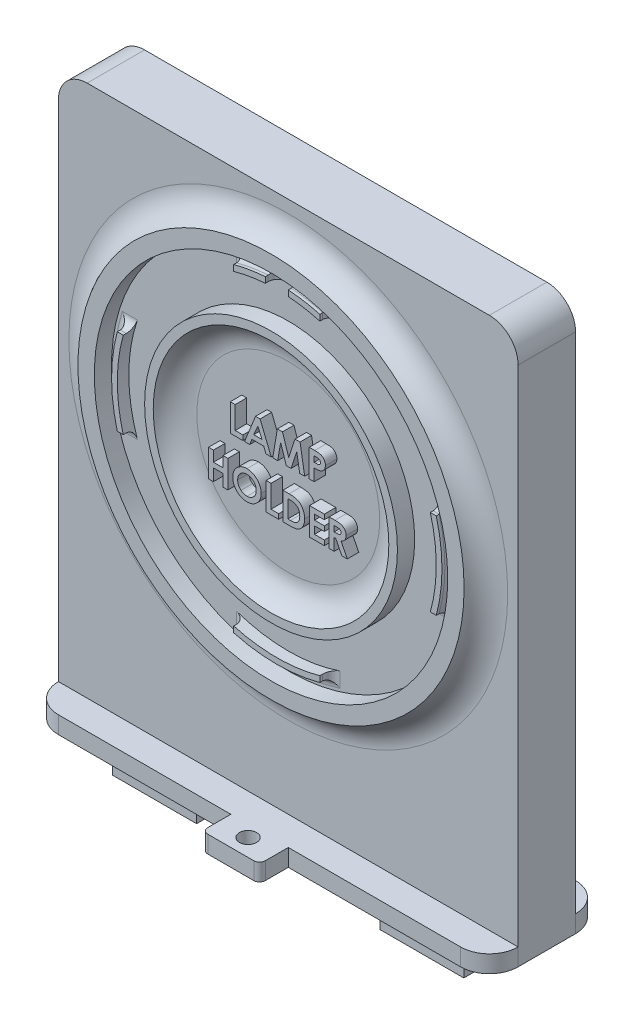
from build123d import *

# Parameters (mm, degrees)
SKETCH1_W           = 80
SKETCH1_H           = 110.7
BOSS_EXTRUDE1_DEPTH = 10
BOSS_EXTRUDE2_DEPTH = 10
SKETCH11_W          = 80
SKETCH11_H          = 15
CUT_EXTRUDE1_DEPTH  = 10
SKETCH4_R           = 1.5
BOSS_EXTRUDE3_DEPTH = 3
SKETCH5_R           = 33.6
SKETCH5_R_2         = 30.75
BOSS_EXTRUDE4_DEPTH = 3
BOSS_EXTRUDE5_DEPTH = 2
SKETCH13_R          = 22
SKETCH13_R_2        = 20.5
BOSS_EXTRUDE6_DEPTH = 3
FILLET1_R           = 5
FILLET2_R           = 1.5
FILLET3_R           = 5
BOSS_EXTRUDE7_DEPTH = 2


with BuildPart() as part:
    # Sketch1 → Boss-Extrude1 (new body)
    with BuildSketch(Plane.XY):
        Rectangle(SKETCH1_W, SKETCH1_H)
    extrude(amount=BOSS_EXTRUDE1_DEPTH)

    # Sketch3 → Boss-Extrude2 (add)
    with BuildSketch(Plane(origin=(0, 0, 0), x_dir=(-1, 0, 0), z_dir=(0, 0, -1))):
        Polygon((-20.95, -59.05), (-15.95, -59.05), (-15.95, -61.75), (-30.55, -61.75), (-30.55, -59.05), (-25.55, -59.05), (-25.55, -55.35), (-20.95, -55.35), align=None)
        Polygon((30.55, -59.05), (30.55, -61.75), (15.95, -61.75), (15.95, -59.05), (20.95, -59.05), (20.95, -55.35), (25.55, -55.35), (25.55, -59.05), align=None)
    extrude(amount=-BOSS_EXTRUDE2_DEPTH)

    # Sketch11 → Cut-Extrude1 (cut)
    with BuildSketch(Plane.XY.offset(10)):
        with Locations((0, 47.85)):
            Rectangle(SKETCH11_W, SKETCH11_H)
    extrude(amount=-CUT_EXTRUDE1_DEPTH, mode=Mode.SUBTRACT)

    # Sketch4 → Boss-Extrude3 (add)
    # profile 1 of 2: a face of its own
    with BuildSketch(Plane.XZ.offset(55.35)):
        with BuildLine():
            Line((20.95, 10), (40, 10))
            ThreePointArc((40, 10), (38.535533906, 13.535533906), (35, 15))
            Line((35, 15), (5, 15))
            Line((5, 15), (5, 19))
            ThreePointArc((5, 19), (4.707106781, 19.707106781), (4, 20))
            Line((4, 20), (-4, 20))
            ThreePointArc((-4, 20), (-4.707106781, 19.707106781), (-5, 19))
            Line((-5, 19), (-5, 15))
            Line((-5, 15), (-35, 15))
            ThreePointArc((-35, 15), (-38.535533906, 13.535533906), (-40, 10))
            Line((-40, 10), (-20.95, 10))
            Line((-20.95, 10), (20.95, 10))
        make_face()
        with Locations(Location((0, 17, 0), (0, 0, 270))):
            Circle(SKETCH4_R, mode=Mode.SUBTRACT)
    # profile 2 of 2: a face of its own
    with BuildSketch(Plane.XZ.offset(55.35)):
        with BuildLine():
            Line((5, -9), (5, -5))
            Line((5, -5), (35, -5))
            ThreePointArc((35, -5), (38.535533906, -3.535533906), (40, 0))
            Line((40, 0), (20.95, 0))
            Line((20.95, 0), (-20.95, 0))
            Line((-20.95, 0), (-40, 0))
            ThreePointArc((-40, 0), (-38.535533906, -3.535533906), (-35, -5))
            Line((-35, -5), (-5, -5))
            Line((-5, -5), (-5, -9))
            ThreePointArc((-5, -9), (-4.707106781, -9.707106781), (-4, -10))
            Line((-4, -10), (4, -10))
            ThreePointArc((4, -10), (4.707106781, -9.707106781), (5, -9))
        make_face()
        with Locations(Location((0, -7, 0), (0, 0, 270))):
            Circle(SKETCH4_R, mode=Mode.SUBTRACT)
    extrude(amount=-BOSS_EXTRUDE3_DEPTH)

    # Sketch5 → Boss-Extrude4 (add)
    with BuildSketch(Plane.XY.offset(10)):
        Circle(SKETCH5_R)
        Circle(SKETCH5_R_2, mode=Mode.SUBTRACT)
    extrude(amount=BOSS_EXTRUDE4_DEPTH)

    # Sketch12 → Boss-Extrude5 (add)
    with BuildSketch(Plane.XY.offset(10)):
        with BuildLine():
            ThreePointArc((-2, 28.680350416), (-4.772504356, 28.351114655), (-7.5, 27.754504139))
            Line((-7.5, 27.754504139), (-7.5, 26.717269696))
            ThreePointArc((-7.5, 26.717269696), (-4.774219412, 27.33622741), (-2, 27.677834092))
            Line((-2, 27.677834092), (-2, 28.680350416))
        make_face()
        with BuildLine():
            Line((7.5, 26.717269696), (7.5, 27.754504139))
            ThreePointArc((7.5, 27.754504139), (4.772504356, 28.351114655), (2, 28.680350416))
            Line((2, 28.680350416), (2, 27.677834092))
            ThreePointArc((2, 27.677834092), (4.774219412, 27.33622741), (7.5, 26.717269696))
        make_face()
        with BuildLine():
            Line((-26.717269696, 7.5), (-27.754504139, 7.5))
            ThreePointArc((-27.754504139, 7.5), (-28.75, 0), (-27.754504139, -7.5))
            Line((-27.754504139, -7.5), (-26.717269696, -7.5))
            ThreePointArc((-26.717269696, -7.5), (-27.75, 0), (-26.717269696, 7.5))
        make_face()
        with BuildLine():
            ThreePointArc((28.75, 0), (28.500039421, 3.782889504), (27.754504139, 7.5))
            Line((27.754504139, 7.5), (26.717269696, 7.5))
            ThreePointArc((26.717269696, 7.5), (27.490605068, 3.785384125), (27.75, 0))
            ThreePointArc((27.75, 0), (27.490605068, -3.785384125), (26.717269696, -7.5))
            Line((26.717269696, -7.5), (27.754504139, -7.5))
            ThreePointArc((27.754504139, -7.5), (28.500039421, -3.782889504), (28.75, 0))
        make_face()
        with BuildLine():
            Line((-7.5, -26.717269696), (-7.5, -27.754504139))
            ThreePointArc((-7.5, -27.754504139), (0, -28.75), (7.5, -27.754504139))
            Line((7.5, -27.754504139), (7.5, -26.717269696))
            ThreePointArc((7.5, -26.717269696), (0, -27.75), (-7.5, -26.717269696))
        make_face()
    extrude(amount=BOSS_EXTRUDE5_DEPTH)

    # Sketch13 → Boss-Extrude6 (add)
    with BuildSketch(Plane.XY.offset(10)):
        Circle(SKETCH13_R)
        Circle(SKETCH13_R_2, mode=Mode.SUBTRACT)
    extrude(amount=BOSS_EXTRUDE6_DEPTH)

    # Fillet1
    # the kernel refuses this fillet: 5 mm, written as the material it adds along each edge
    with BuildSketch(Plane(origin=(0, 0, 10), x_dir=(1, 0, 0), z_dir=(0, -1, 0))) as fillet1_piece_1:
        with BuildLine():
            CenterArc((38.182575695, 5), FILLET1_R, 203.578178478, 66.421821522)
            Line((33.6, 3), (33.508348486, 2.96))
            ThreePointArc((33.508348486, 2.96), (33.5, 1.5), (33.5, 0))
            Line((33.5, 0), (33.6, -0.1))
            Line((33.6, -0.1), (38.182575695, -0.1))
            Line((38.182575695, -0.1), (38.182575695, 0))
        make_face()
    revolve(axis=Axis((0, 0, 10), (0, 0, 1)))
    with BuildSketch(Plane(origin=(0, 0, 10), x_dir=(1, 0, 0), z_dir=(0, -1, 0))) as fillet1_piece_2:
        with BuildLine():
            CenterArc((15.917424305, 5), FILLET1_R, 270, 66.421821522)
            Line((15.917424305, 0), (15.917424305, -0.1))
            Line((15.917424305, -0.1), (20.5, -0.1))
            Line((20.5, -0.1), (20.6, 0))
            ThreePointArc((20.6, 0), (20.6, 1.5), (20.591651514, 2.96))
            Line((20.591651514, 2.96), (20.5, 3))
        make_face()
    revolve(axis=Axis((0, 0, 10), (0, 0, 1)))

    # Fillet2
    fillet2_edges = [part.edges().sort_by_distance(p)[0] for p in [
        (-4.772504356, 28.351114655, 10),
        (-7.5, 27.235886917, 10),
        (-2, 28.179092254, 10),
        (4.772504356, 28.351114655, 10),
        (2, 28.179092254, 10),
        (7.5, 27.235886917, 10),
        (-28.75, 0, 10),
        (-27.235886917, -7.5, 10),
        (-27.235886917, 7.5, 10),
        (27.235886917, -7.5, 10),
        (28.75, 0, 10),
        (27.235886917, 7.5, 10),
        (-7.5, -27.235886917, 10),
        (0, -28.75, 10),
        (7.5, -27.235886917, 10),
    ]]
    fillet(fillet2_edges, radius=FILLET2_R)

    # Fillet3
    fillet3_edges = [part.edges().sort_by_distance(p)[0] for p in [
        (40, 40.35, 5),
        (-40, 40.35, 5),
    ]]
    fillet(fillet3_edges, radius=FILLET3_R)

    # Sketch14 → Boss-Extrude7 (add)
    # profile 1 of 10: a face of its own
    with BuildSketch(Plane.XY.offset(10)):
        with BuildLine():
            Line((5.647836538, 6.784743934), (6.601862981, 6.784743934))
            add(Edge.make_bspline(
                [(6.601862981, 6.784743934), (6.664197831, 6.78446491), (6.784454823, 6.783926614), (6.957875299, 6.777399061), (7.11786418, 6.765701287), (7.264384708, 6.751244688), (7.397376637, 6.730977099), (7.517006513, 6.707741896), (7.623299163, 6.679434655), (7.717453193, 6.645834353), (7.801953394, 6.60622091), (7.881917838, 6.564029765), (7.95553932, 6.513676122), (8.026533738, 6.460586882), (8.090842219, 6.39969045), (8.152476711, 6.335039574), (8.208826825, 6.264070251), (8.260153667, 6.187641546), (8.306715022, 6.107165536), (8.347394136, 6.022498353), (8.380390755, 5.933506019), (8.408070816, 5.840764215), (8.43030371, 5.744276982), (8.445102632, 5.643450914), (8.455154805, 5.538990019), (8.45604177, 5.467893868), (8.456490385, 5.431934439)],
                knots=[0, 0, 0, 0, 1.698747864, 3.27724071, 4.728299578, 6.070144658, 7.288476769, 8.393259625, 9.389771311, 10.283485332, 11.113357557, 11.931608583, 12.74405601, 13.541433047, 14.344816069, 15.154114104, 15.974336324, 16.810834471, 17.661136416, 18.50621059, 19.367396281, 20.244825668, 21.142564693, 22.063065223, 23.020325768, 24, 24, 24, 24], degree=3))
            add(Edge.make_bspline(
                [(8.456490385, 5.431934439), (8.455841295, 5.39215338), (8.454565756, 5.313978709), (8.442061354, 5.199384234), (8.420699886, 5.090128776), (8.392781564, 4.985290966), (8.35385145, 4.886595618), (8.309375623, 4.791687831), (8.254656248, 4.703228527), (8.192130614, 4.620111187), (8.123845489, 4.541660029), (8.048179787, 4.47014018), (7.966575728, 4.405064093), (7.879505689, 4.345749766), (7.786642783, 4.292316847), (7.688054015, 4.244264995), (7.583066165, 4.203131058), (7.509955785, 4.181618341), (7.472889123, 4.170711482)],
                knots=[0, 0, 0, 0, 1.102006807, 2.165578795, 3.188629044, 4.184801286, 5.166646146, 6.124351954, 7.085497154, 8.042432466, 9.003981491, 9.963833307, 10.922997304, 11.89326795, 12.880200226, 13.889073926, 14.929769137, 16, 16, 16, 16], degree=3))
            add(Edge.make_bspline(
                [(7.472889123, 4.170711482), (7.448474886, 4.164637181), (7.395585789, 4.151478288), (7.308068859, 4.138118709), (7.207214786, 4.125835397), (7.092697443, 4.115279377), (6.964450808, 4.108103744), (6.822599057, 4.102499893), (6.667077905, 4.098425315), (6.558934646, 4.098280731), (6.502644231, 4.098205473)],
                knots=[0, 0, 0, 0, 0.618981996, 1.340914327, 2.176866532, 3.120127938, 4.170906482, 5.338178032, 6.614476169, 8, 8, 8, 8], degree=3))
            Line((6.502644231, 4.098205473), (6.502644231, 2.022243934))
            Line((6.502644231, 2.022243934), (5.647836538, 2.022243934))
            Line((5.647836538, 2.022243934), (5.647836538, 6.784743934))
        make_face()
        with BuildLine():
            Line((6.502644231, 4.953013165), (6.805070613, 4.953013165))
            add(Edge.make_bspline(
                [(6.805070613, 4.953013165), (6.860101868, 4.953362106), (6.961360194, 4.954004162), (7.099643311, 4.963288671), (7.210770283, 4.977467991), (7.298562655, 4.997804415), (7.367883048, 5.028667631), (7.427667547, 5.06437056), (7.478946238, 5.109515934), (7.523346037, 5.161102248), (7.558842338, 5.220377509), (7.583457174, 5.286376533), (7.599446487, 5.357712611), (7.600923249, 5.4073578), (7.601682692, 5.432888466)],
                knots=[0, 0, 0, 0, 1.8619151, 3.425951444, 4.686033666, 5.651700536, 6.461346321, 7.243864085, 7.999046032, 8.762387399, 9.539336099, 10.322741239, 11.137448474, 12, 12, 12, 12], degree=3))
            add(Edge.make_bspline(
                [(7.601682692, 5.432888466), (7.600931061, 5.455194276), (7.599472715, 5.498472911), (7.588759311, 5.560934717), (7.571685226, 5.619162005), (7.546945534, 5.672546668), (7.514962969, 5.720997999), (7.475969751, 5.764496909), (7.430466239, 5.803974964), (7.395334867, 5.824871302), (7.377486478, 5.835487624)],
                knots=[0, 0, 0, 0, 1.102301479, 2.1387299, 3.123554645, 4.094223062, 5.036071848, 5.982632524, 6.975082478, 8, 8, 8, 8], degree=3))
            add(Edge.make_bspline(
                [(7.377486478, 5.835487624), (7.362367863, 5.843133542), (7.330358656, 5.859321515), (7.275843873, 5.878141219), (7.212934646, 5.894017711), (7.141206267, 5.907195047), (7.060944881, 5.917422028), (6.972164807, 5.92524311), (6.874735398, 5.928388272), (6.806979074, 5.92940602), (6.771679687, 5.929936242)],
                knots=[0, 0, 0, 0, 0.656809284, 1.390599849, 2.23162475, 3.173112763, 4.218524733, 5.370385145, 6.63003504, 8, 8, 8, 8], degree=3))
            Line((6.771679687, 5.929936242), (6.502644231, 5.929936242))
            Line((6.502644231, 5.929936242), (6.502644231, 4.953013165))
        make_face(mode=Mode.SUBTRACT)
    # profile 2 of 10: a face of its own
    with BuildSketch(Plane.XY.offset(10)):
        Polygon((0.102080829, 6.784743934), (0.989325421, 6.784743934), (2.075961538, 3.462823862), (3.170229868, 6.784743934), (4.048888221, 6.784743934), (4.854086538, 2.022243934), (3.988784555, 2.022243934), (3.480288462, 5.030289307), (2.490009014, 2.022243934), (1.656189904, 2.022243934), (0.671634615, 5.030289307), (0.164092548, 2.022243934), (-0.702163462, 2.022243934), align=None)
    # profile 3 of 10: a face of its own
    with BuildSketch(Plane.XY.offset(10)):
        Polygon((-3.693036358, 6.784743934), (-2.900240385, 6.784743934), (-0.976923077, 2.022243934), (-1.889926382, 2.022243934), (-2.260088642, 2.999167011), (-4.335096154, 2.999167011), (-4.705258413, 2.022243934), (-5.617307692, 2.022243934), align=None)
        Polygon((-3.297115385, 5.507302528), (-4.010727163, 3.853974704), (-2.583503606, 3.853974704), align=None, mode=Mode.SUBTRACT)
    # profile 4 of 10: a face of its own
    with BuildSketch(Plane.XY.offset(10)):
        Polygon((-8.090144231, 6.784743934), (-7.235336538, 6.784743934), (-7.235336538, 2.877051627), (-5.892067308, 2.877051627), (-5.892067308, 2.022243934), (-8.090144231, 2.022243934), align=None)
    # profile 5 of 10: a face of its own
    with BuildSketch(Plane.XY.offset(10)):
        with BuildLine():
            Line((9.128125, -1.969582989), (10.124128606, -1.969582989))
            add(Edge.make_bspline(
                [(10.124128606, -1.969582989), (10.189964141, -1.969816667), (10.31658442, -1.970266096), (10.499163946, -1.977356901), (10.66688835, -1.987224337), (10.820005963, -2.002282306), (10.958451277, -2.022247353), (11.082363049, -2.04578284), (11.191737655, -2.072606573), (11.287497521, -2.106031061), (11.373916064, -2.143733376), (11.45447016, -2.187054028), (11.530936954, -2.235510627), (11.602805346, -2.290378197), (11.67069989, -2.350669685), (11.734748674, -2.41644578), (11.794046628, -2.488264235), (11.848226577, -2.56567125), (11.897607239, -2.647101654), (11.941249387, -2.732667253), (11.976739255, -2.822427551), (12.008098358, -2.915085318), (12.030685303, -3.011965115), (12.046394194, -3.1121238), (12.057895628, -3.215913944), (12.058556906, -3.28642436), (12.058894231, -3.322392484)],
                knots=[0, 0, 0, 0, 1.749336639, 3.364467119, 4.854658419, 6.213483162, 7.451590619, 8.570285859, 9.5643256, 10.440900261, 11.26203566, 12.067320669, 12.869050712, 13.665104639, 14.467235401, 15.27997916, 16.102287765, 16.939272006, 17.78853747, 18.631303466, 19.488103222, 20.351255419, 21.228522269, 22.127379805, 23.044756219, 24, 24, 24, 24], degree=3))
            add(Edge.make_bspline(
                [(12.058894231, -3.322392484), (12.058017982, -3.359934943), (12.056299819, -3.433548863), (12.047044854, -3.541681707), (12.030129687, -3.645135648), (12.004509205, -3.743607787), (11.975061789, -3.838323724), (11.935904279, -3.92753589), (11.891711159, -4.012541747), (11.839224282, -4.092138855), (11.781622498, -4.168095225), (11.714632836, -4.237500687), (11.642595195, -4.304085521), (11.561460078, -4.36367908), (11.474803997, -4.420310863), (11.380905186, -4.471634341), (11.28037646, -4.518939667), (11.209699788, -4.545320384), (11.173557692, -4.558810753)],
                knots=[0, 0, 0, 0, 1.099860209, 2.156625411, 3.176576793, 4.16617041, 5.135385252, 6.078461593, 7.016046972, 7.938469504, 8.868247731, 9.803980173, 10.76021508, 11.73834243, 12.748633912, 13.790971185, 14.870363756, 16, 16, 16, 16], degree=3))
            Line((11.173557692, -4.558810753), (12.272596154, -6.732082989))
            Line((12.272596154, -6.732082989), (11.322385817, -6.732082989))
            Line((11.322385817, -6.732082989), (10.272956731, -4.65612145))
            Line((10.272956731, -4.65612145), (9.982932692, -4.65612145))
            Line((9.982932692, -4.65612145), (9.982932692, -6.732082989))
            Line((9.982932692, -6.732082989), (9.128125, -6.732082989))
            Line((9.128125, -6.732082989), (9.128125, -1.969582989))
        make_face()
        with BuildLine():
            Line((9.982932692, -3.801313758), (10.315887921, -3.801313758))
            add(Edge.make_bspline(
                [(10.315887921, -3.801313758), (10.356594465, -3.800855293), (10.434538751, -3.799977433), (10.546632871, -3.79590555), (10.648441065, -3.786094324), (10.740400532, -3.773698207), (10.822974003, -3.7593851), (10.895424952, -3.738873548), (10.958869739, -3.716894901), (11.012556538, -3.689581145), (11.058425306, -3.658519479), (11.098030052, -3.623232655), (11.130788855, -3.582392649), (11.157751021, -3.537109317), (11.178724654, -3.486982138), (11.1940338, -3.432561396), (11.202589349, -3.373227168), (11.203573694, -3.332278472), (11.204086538, -3.310944167)],
                knots=[0, 0, 0, 0, 1.688639943, 3.233382647, 4.650958383, 5.928841754, 7.082724185, 8.122798841, 9.049171256, 9.863274652, 10.613301712, 11.341792392, 12.054588806, 12.776240173, 13.521029143, 14.301969904, 15.115324896, 16, 16, 16, 16], degree=3))
            add(Edge.make_bspline(
                [(11.204086538, -3.310944167), (11.203116959, -3.285704126), (11.201212399, -3.236124744), (11.182313251, -3.164747818), (11.152229891, -3.098683589), (11.110993842, -3.038230553), (11.059062401, -2.985233248), (10.999466974, -2.938515702), (10.93092135, -2.901574962), (10.86745326, -2.877209243), (10.809712133, -2.862630982), (10.757602588, -2.851767391), (10.69725942, -2.844068052), (10.628637075, -2.835901533), (10.551910473, -2.830605958), (10.466661409, -2.826741245), (10.373134716, -2.82516), (10.307937728, -2.824654504), (10.273910757, -2.824390681)],
                knots=[0, 0, 0, 0, 1.020303359, 2.004196876, 2.966617323, 3.9489082, 4.950758222, 5.960522915, 7.003732012, 8.091992268, 8.70421221, 9.413913587, 10.24622431, 11.166358409, 12.212345909, 13.359657661, 14.621978493, 16, 16, 16, 16], degree=3))
            Line((10.273910757, -2.824390681), (9.982932692, -2.824390681))
            Line((9.982932692, -2.824390681), (9.982932692, -3.801313758))
        make_face(mode=Mode.SUBTRACT)
    # profile 6 of 10: a face of its own
    with BuildSketch(Plane.XY.offset(10)):
        Polygon((5.708894231, -1.969582989), (8.273317308, -1.969582989), (8.273317308, -2.824390681), (6.563701923, -2.824390681), (6.563701923, -3.740256066), (8.273317308, -3.740256066), (8.273317308, -4.595063758), (6.563701923, -4.595063758), (6.563701923, -5.877275296), (8.273317308, -5.877275296), (8.273317308, -6.732082989), (5.708894231, -6.732082989), align=None)
    # profile 7 of 10: a face of its own
    with BuildSketch(Plane.XY.offset(10)):
        with BuildLine():
            Line((1.068509615, -1.969582989), (2.145605469, -1.969582989))
            add(Edge.make_bspline(
                [(2.145605469, -1.969582989), (2.229577479, -1.970169982), (2.391896325, -1.971304646), (2.627064221, -1.984089584), (2.845740438, -2.003751911), (3.048065939, -2.030801004), (3.233625926, -2.066594362), (3.402181121, -2.111490115), (3.554297237, -2.163314792), (3.691642195, -2.224297041), (3.817024932, -2.295396287), (3.936079841, -2.374595139), (4.048573163, -2.464794882), (4.156083563, -2.564255384), (4.257223595, -2.674796244), (4.353677605, -2.794586504), (4.44308396, -2.925363289), (4.528145222, -3.063990984), (4.605071814, -3.21105708), (4.672170062, -3.365309781), (4.728378671, -3.525756413), (4.774051077, -3.69256797), (4.810457255, -3.86519069), (4.835929924, -4.043972908), (4.851677382, -4.228749102), (4.85327483, -4.353981001), (4.854086538, -4.41761484)],
                knots=[0, 0, 0, 0, 1.44355588, 2.790409838, 4.047694926, 5.217575253, 6.298404546, 7.294384826, 8.214239204, 9.058592145, 9.873746385, 10.689560431, 11.514393297, 12.350027578, 13.205127629, 14.088021785, 14.991911688, 15.926770944, 16.882954281, 17.842803888, 18.816321264, 19.80318086, 20.814351908, 21.847355356, 22.906180909, 24, 24, 24, 24], degree=3))
            add(Edge.make_bspline(
                [(4.854086538, -4.41761484), (4.851961049, -4.507406328), (4.847776897, -4.684166129), (4.812531943, -4.943559101), (4.755528918, -5.192213136), (4.675377488, -5.428183166), (4.576011171, -5.649367842), (4.457306978, -5.851866667), (4.321005389, -6.034592728), (4.168694326, -6.1966362), (4.00377854, -6.335914761), (3.832397783, -6.455196656), (3.652882494, -6.549260383), (3.494704436, -6.608910852), (3.357544327, -6.646008283), (3.237119234, -6.667933222), (3.100328616, -6.688039714), (2.94589702, -6.703577578), (2.774501902, -6.717433534), (2.585460081, -6.724962322), (2.379383618, -6.731217626), (2.23624403, -6.731786976), (2.161823918, -6.732082989)],
                knots=[0, 0, 0, 0, 1.315458931, 2.589557908, 3.828601765, 5.048913369, 6.235739168, 7.376350998, 8.481830359, 9.569842114, 10.627874879, 11.640079404, 12.624025415, 13.590060155, 14.111227486, 14.704434459, 15.382649715, 16.137166398, 16.978595427, 17.902333227, 18.909396075, 20, 20, 20, 20], degree=3))
            Line((2.161823918, -6.732082989), (1.068509615, -6.732082989))
            Line((1.068509615, -6.732082989), (1.068509615, -1.969582989))
        make_face()
        with BuildLine():
            Line((1.923317308, -2.824390681), (1.923317308, -5.877275296))
            Line((1.923317308, -5.877275296), (2.369801683, -5.877275296))
            add(Edge.make_bspline(
                [(2.369801683, -5.877275296), (2.422926466, -5.87717795), (2.525103111, -5.87699072), (2.672623056, -5.868072797), (2.809041601, -5.859121663), (2.933983217, -5.842132109), (3.04835719, -5.823206942), (3.150592322, -5.796869981), (3.242796121, -5.769205234), (3.323842338, -5.733984583), (3.398074069, -5.694341396), (3.466804173, -5.647894806), (3.533147967, -5.59631762), (3.595865098, -5.538092879), (3.655192938, -5.473991588), (3.710780464, -5.403683462), (3.763369624, -5.327383012), (3.811610553, -5.24468682), (3.855693371, -5.156468176), (3.894799771, -5.063581605), (3.927224748, -4.965253564), (3.954174403, -4.86240452), (3.973432987, -4.754139056), (3.989365792, -4.641259079), (3.997579618, -4.523317369), (3.998706914, -4.443065887), (3.999278846, -4.402350417)],
                knots=[0, 0, 0, 0, 1.50275155, 2.890291501, 4.180787663, 5.369391935, 6.45668281, 7.458360028, 8.354766181, 9.177074746, 9.954075863, 10.732690366, 11.5210699, 12.329727389, 13.151100085, 13.990027547, 14.863562427, 15.770965086, 16.696477834, 17.652329173, 18.619756807, 19.62365428, 20.657822005, 21.729286259, 22.847956731, 24, 24, 24, 24], degree=3))
            add(Edge.make_bspline(
                [(3.999278846, -4.402350417), (3.998139752, -4.339957807), (3.995918605, -4.218297051), (3.974498351, -4.041095506), (3.939630263, -3.874233705), (3.889876862, -3.718330917), (3.827161157, -3.572948974), (3.748657833, -3.439319569), (3.65774537, -3.315197911), (3.585854275, -3.242384164), (3.549932392, -3.206001258)],
                knots=[0, 0, 0, 0, 1.13821349, 2.219428113, 3.251817212, 4.244760574, 5.201143372, 6.134805572, 7.068016741, 8, 8, 8, 8], degree=3))
            add(Edge.make_bspline(
                [(3.549932392, -3.206001258), (3.514510013, -3.174998104), (3.442163816, -3.111677672), (3.315147668, -3.035803601), (3.175182452, -2.969140792), (3.019066182, -2.91628462), (2.848307653, -2.874483705), (2.661889824, -2.845654637), (2.460811002, -2.827129383), (2.32150828, -2.82532314), (2.249594351, -2.824390681)],
                knots=[0, 0, 0, 0, 0.813307809, 1.661089106, 2.549956539, 3.493439533, 4.508053171, 5.589449661, 6.755572447, 8, 8, 8, 8], degree=3))
            Line((2.249594351, -2.824390681), (1.923317308, -2.824390681))
        make_face(mode=Mode.SUBTRACT)
    # profile 8 of 10: a face of its own
    with BuildSketch(Plane.XY.offset(10)):
        Polygon((-1.862259615, -1.969582989), (-1.007451923, -1.969582989), (-1.007451923, -5.877275296), (0.335817308, -5.877275296), (0.335817308, -6.732082989), (-1.862259615, -6.732082989), align=None)
    # profile 9 of 10: a face of its own
    with BuildSketch(Plane.XY.offset(10)):
        with BuildLine():
            add(Edge.make_bspline(
                [(-5.180363582, -1.847467604), (-5.097561682, -1.849611494), (-4.934091979, -1.853844017), (-4.693687036, -1.889125402), (-4.462012422, -1.946611362), (-4.2391729, -2.026521004), (-4.025726436, -2.131018687), (-3.820920131, -2.257141834), (-3.625487592, -2.407270943), (-3.441431455, -2.57790375), (-3.27133039, -2.763459477), (-3.123937717, -2.963243206), (-2.998246653, -3.17207834), (-2.894073563, -3.39052446), (-2.814726365, -3.620094408), (-2.759045155, -3.859617681), (-2.723272735, -4.109026138), (-2.719158357, -4.278839302), (-2.717067308, -4.365143385)],
                knots=[0, 0, 0, 0, 1.014329547, 2.002516266, 2.970391464, 3.935626869, 4.897733899, 5.877609409, 6.878433252, 7.912639331, 8.949961323, 9.958554974, 10.949718813, 11.932905612, 12.9188844, 13.919928257, 14.942845884, 16, 16, 16, 16], degree=3))
            add(Edge.make_bspline(
                [(-2.717067308, -4.365143385), (-2.719294185, -4.450475021), (-2.723682317, -4.618623747), (-2.757584768, -4.865733807), (-2.814203657, -5.102691287), (-2.892205064, -5.330032546), (-2.994488848, -5.546656422), (-3.1177288, -5.753946027), (-3.265176986, -5.949977665), (-3.431455394, -6.134646137), (-3.61451349, -6.302272401), (-3.808401074, -6.449992756), (-4.012222893, -6.575165411), (-4.225680617, -6.67773303), (-4.449231994, -6.757331982), (-4.682324828, -6.813494826), (-4.924944692, -6.84762612), (-5.089937966, -6.85198559), (-5.173685397, -6.854198373)],
                knots=[0, 0, 0, 0, 1.051557043, 2.072126891, 3.067553643, 4.050577992, 5.02905126, 6.015227836, 7.017913613, 8.04756643, 9.074058332, 10.072836633, 11.047628519, 12.017157415, 12.98668631, 13.966869689, 14.968021931, 16, 16, 16, 16], degree=3))
            add(Edge.make_bspline(
                [(-5.173685397, -6.854198373), (-5.261275167, -6.852213398), (-5.433377095, -6.848313192), (-5.685249036, -6.811224013), (-5.926564119, -6.755354753), (-6.155295158, -6.67197288), (-6.373771584, -6.567738528), (-6.580388186, -6.439367674), (-6.775075528, -6.287072461), (-6.95671685, -6.114753226), (-7.121284328, -5.926198187), (-7.266547407, -5.727006509), (-7.389080036, -5.518699842), (-7.4888867, -5.301180694), (-7.567570264, -5.075800892), (-7.623072578, -4.84118781), (-7.65585912, -4.597904134), (-7.660426095, -4.432660998), (-7.662740385, -4.348924936)],
                knots=[0, 0, 0, 0, 1.067978421, 2.098431617, 3.099715153, 4.085208694, 5.062210972, 6.048429807, 7.046490867, 8.072918869, 9.098532598, 10.095778865, 11.076610158, 12.041847152, 13.011192615, 13.984257998, 14.978533688, 16, 16, 16, 16], degree=3))
            add(Edge.make_bspline(
                [(-7.662740385, -4.348924936), (-7.662014027, -4.292591697), (-7.66057051, -4.180638528), (-7.643181821, -4.014729645), (-7.618147108, -3.852059081), (-7.581121955, -3.693275406), (-7.536145858, -3.537258474), (-7.477872971, -3.38546053), (-7.411542656, -3.236259954), (-7.334041928, -3.091418993), (-7.247868612, -2.952270303), (-7.153845851, -2.819470273), (-7.051737228, -2.694624651), (-6.941871668, -2.576913001), (-6.823870558, -2.467109051), (-6.699286083, -2.363658374), (-6.565702028, -2.269308987), (-6.426042129, -2.181756691), (-6.281093757, -2.102584667), (-6.131446983, -2.035195808), (-5.980184826, -1.976346266), (-5.825286628, -1.929899604), (-5.668412398, -1.892069285), (-5.507886254, -1.867051445), (-5.345158457, -1.849663238), (-5.235425571, -1.848201219), (-5.180363582, -1.847467604)],
                knots=[0, 0, 0, 0, 1.034744296, 2.056386356, 3.06226378, 4.057406941, 5.050368692, 6.043467995, 7.042652155, 8.049140477, 9.059438543, 10.048523776, 11.036952808, 12.020949711, 13.004946614, 13.997082645, 14.994316842, 16.007702937, 17.024872941, 18.026463647, 19.021641123, 20.005082605, 20.995858141, 21.984425357, 22.988620895, 24, 24, 24, 24], degree=3))
        make_face()
        with BuildLine():
            add(Edge.make_bspline(
                [(-5.193719952, -2.702275296), (-5.249445619, -2.703770541), (-5.359425787, -2.706721556), (-5.520746664, -2.729204298), (-5.675620403, -2.765111792), (-5.823188477, -2.817123358), (-5.96409046, -2.883320881), (-6.098576127, -2.963473059), (-6.22478313, -3.060335034), (-6.344394316, -3.168706717), (-6.452443341, -3.289457677), (-6.547908063, -3.418862867), (-6.627796659, -3.556706182), (-6.694703859, -3.701707091), (-6.745070151, -3.855496089), (-6.780944552, -4.016868531), (-6.803615833, -4.18610247), (-6.806473577, -4.301469026), (-6.807932692, -4.360373253)],
                knots=[0, 0, 0, 0, 1.033739768, 2.040188636, 3.016340934, 3.979330865, 4.937572243, 5.900995986, 6.878200029, 7.884839167, 8.891893314, 9.879764717, 10.863503415, 11.843163062, 12.837761627, 13.859916423, 14.907309254, 16, 16, 16, 16], degree=3))
            add(Edge.make_bspline(
                [(-6.807932692, -4.360373253), (-6.805998128, -4.425652387), (-6.802206701, -4.553588672), (-6.775529765, -4.740218678), (-6.729888183, -4.916472196), (-6.663982626, -5.081487196), (-6.582242445, -5.237096046), (-6.480734113, -5.381391539), (-6.361101584, -5.515237648), (-6.268937653, -5.593382581), (-6.222160457, -5.633044527)],
                knots=[0, 0, 0, 0, 1.078454662, 2.113592447, 3.107694534, 4.079536787, 5.043276885, 6.005368276, 6.987637804, 8, 8, 8, 8], degree=3))
            add(Edge.make_bspline(
                [(-6.222160457, -5.633044527), (-6.183841003, -5.66234525), (-6.108065439, -5.720286545), (-5.98711114, -5.794550201), (-5.86255203, -5.858201562), (-5.733448154, -5.909631109), (-5.600072171, -5.950084726), (-5.462442373, -5.978413729), (-5.320753769, -5.996192628), (-5.224937294, -5.998317543), (-5.176547476, -5.999390681)],
                knots=[0, 0, 0, 0, 1.023928204, 2.024787132, 3.009472467, 3.9914905, 4.972207045, 5.96565515, 6.972602802, 8, 8, 8, 8], degree=3))
            add(Edge.make_bspline(
                [(-5.176547476, -5.999390681), (-5.121780013, -5.997882758), (-5.014023307, -5.994915873), (-4.855705505, -5.972709906), (-4.704032243, -5.935129393), (-4.558061919, -5.88357409), (-4.418215447, -5.8165454), (-4.285176295, -5.733907152), (-4.158711209, -5.63667404), (-4.039252405, -5.526879199), (-3.930061412, -5.405652563), (-3.834795905, -5.275557139), (-3.752367251, -5.139459319), (-3.686851387, -4.995432844), (-3.634495236, -4.844837256), (-3.599052603, -4.687005601), (-3.576189801, -4.522588519), (-3.573331252, -4.410696885), (-3.571875, -4.353695068)],
                knots=[0, 0, 0, 0, 1.026359118, 2.019393844, 2.989460624, 3.950973911, 4.916101784, 5.890408035, 6.881132271, 7.902007068, 8.92769091, 9.933912415, 10.920395702, 11.90457117, 12.894218921, 13.903490204, 14.931958862, 16, 16, 16, 16], degree=3))
            add(Edge.make_bspline(
                [(-3.571875, -4.353695068), (-3.573381639, -4.297021027), (-3.576347228, -4.18546682), (-3.598592278, -4.021472455), (-3.635934466, -3.86433758), (-3.687644583, -3.713805578), (-3.753675665, -3.569728872), (-3.835329797, -3.432614121), (-3.932320463, -3.302593882), (-4.042415431, -3.180554191), (-4.162247037, -3.068407534), (-4.29089824, -2.971084621), (-4.424769234, -2.886514104), (-4.566931673, -2.820264976), (-4.714477032, -2.767484436), (-4.868305643, -2.728616089), (-5.029000138, -2.706879498), (-5.138323926, -2.703823711), (-5.193719952, -2.702275296)],
                knots=[0, 0, 0, 0, 1.055025985, 2.07665775, 3.074803781, 4.057872707, 5.035505728, 6.020516407, 7.023567878, 8.050795229, 9.077271434, 10.074415901, 11.050397877, 12.019801805, 12.988065821, 13.964604439, 14.968634123, 16, 16, 16, 16], degree=3))
        make_face(mode=Mode.SUBTRACT)
    # profile 10 of 10: a face of its own
    with BuildSketch(Plane.XY.offset(10)):
        Polygon((-11.875721154, -1.969582989), (-11.020913462, -1.969582989), (-11.020913462, -3.801313758), (-9.372355769, -3.801313758), (-9.372355769, -1.969582989), (-8.517548077, -1.969582989), (-8.517548077, -6.732082989), (-9.372355769, -6.732082989), (-9.372355769, -4.65612145), (-11.020913462, -4.65612145), (-11.020913462, -6.732082989), (-11.875721154, -6.732082989), align=None)
    extrude(amount=BOSS_EXTRUDE7_DEPTH)


solid = part.part
